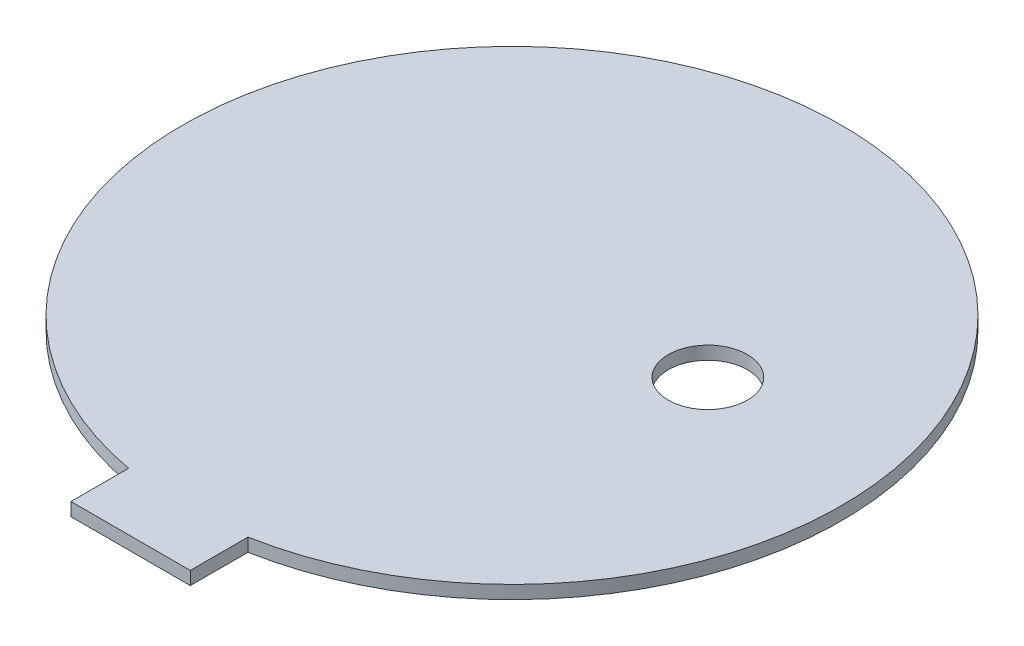
from build123d import *

# Parameters (mm, degrees)
SKETCH13_R          = 50
BOSS_EXTRUDE6_DEPTH = 2
SKETCH15_R          = 6
CUT_EXTRUDE5_DEPTH  = 93.466630636
SKETCH16_W          = 5.9
SKETCH16_H          = 12.9
BOSS_EXTRUDE7_DEPTH = 2
BOSS_EXTRUDE8_START = -2
BOSS_EXTRUDE8_DEPTH = 2
BOSS_EXTRUDE9_DEPTH = 2


with BuildPart() as part:
    # Sketch13 → Boss-Extrude6 (new body)
    with BuildSketch(Plane(origin=(0, 0, 0), x_dir=(1, 0, 0), z_dir=(0, 1, 0))):
        with Locations((-23, -6.719289322)):
            Circle(SKETCH13_R)
    extrude(amount=BOSS_EXTRUDE6_DEPTH)

    # Sketch15 → Cut-Extrude5 (cut, through all)
    with BuildSketch(Plane(origin=(0, 2, 0), x_dir=(1, 0, 0), z_dir=(0, 1, 0))):
        Circle(SKETCH15_R)
    extrude(amount=-CUT_EXTRUDE5_DEPTH, mode=Mode.SUBTRACT)

    # Sketch16 → Boss-Extrude7 (add)
    with BuildSketch(Plane(origin=(0, 2, 0), x_dir=(1, 0, 0), z_dir=(0, 1, 0))):
        with Locations((-22.95, -54.78)):
            Rectangle(SKETCH16_W, SKETCH16_H)
    extrude(amount=-BOSS_EXTRUDE7_DEPTH)

    # Sketch17 → Boss-Extrude8 (add)
    with BuildSketch(Plane(origin=(0, 2, 0), x_dir=(1, 0, 0), z_dir=(0, 1, 0)).offset(BOSS_EXTRUDE8_START)):
        with BuildLine():
            Line((-20, -61.23), (-25.9, -61.23))
            Line((-25.9, -61.23), (-25.9, -56.635118475))
            ThreePointArc((-25.9, -56.635118475), (-25.95000148, -56.632188369), (-26, -56.629208176))
            Line((-26, -56.629208176), (-32, -56.629208176))
            Line((-32, -56.629208176), (-32, -64.635118475))
            Line((-32, -64.635118475), (-13.9, -64.635118475))
            Line((-13.9, -64.635118475), (-13.9, -56.635118475))
            Line((-13.9, -56.635118475), (-20, -56.635118475))
            Line((-20, -56.635118475), (-20, -61.23))
        make_face()
    extrude(amount=BOSS_EXTRUDE8_DEPTH)

    # Sketch18 → Boss-Extrude9 (add)
    with BuildSketch(Plane(origin=(0, 2, 0), x_dir=(1, 0, 0), z_dir=(0, 1, 0))):
        Polygon((-32, -56.629208176), (-32, -55.902619831), (-26, -56.629208176), align=None)
        Polygon((-13.9, -56.635118475), (-13.9, -55.884215845), (-20, -56.635118475), align=None)
    extrude(amount=-BOSS_EXTRUDE9_DEPTH)


solid = part.part
